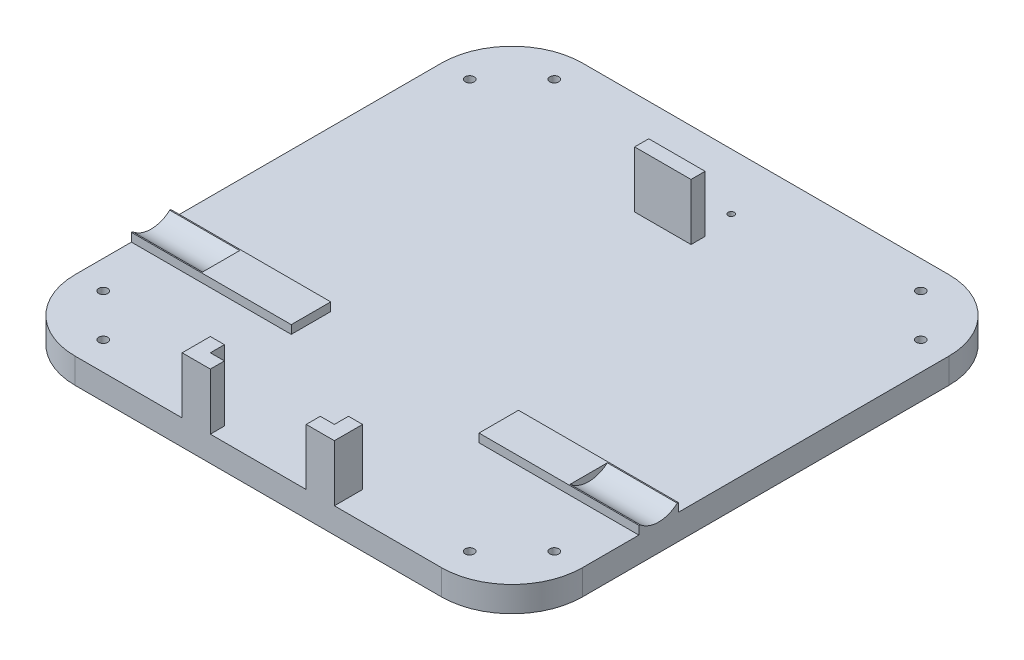
from build123d import *

# Parameters (mm, degrees)
PLATE_DEPTH         = 9
SKETCH2_R           = 1.09
CASTER_HOLES_DEPTH  = 128.597021909
SKETCH3_R           = 1.6
HEX_HOLES_DEPTH     = 128.597021909
SKETCH4_W           = 20
SKETCH4_H           = 5
BOSS_EXTRUDE1_DEPTH = 20
SKETCH5_W           = 56.7
SKETCH5_H           = 14
BOSS_EXTRUDE2_DEPTH = 3
SKETCH6_R           = 10
CUT_EXTRUDE1_DEPTH  = 24.8
CUT_EXTRUDE2_START  = -24.8
SKETCH7_R           = 10
CUT_EXTRUDE2_DEPTH  = 24.8


with BuildPart() as part:
    # Sketch1 → Plate (new body)
    with BuildSketch(Plane(origin=(0, 0, 0), x_dir=(1, 0, 0), z_dir=(0, 1, 0))):
        with BuildLine():
            Line((-65, -90), (65, -90))
            ThreePointArc((65, -90), (82.67766953, -82.67766953), (90, -65))
            Line((90, -65), (90, 65))
            ThreePointArc((90, 65), (82.67766953, 82.67766953), (65, 90))
            Line((65, 90), (-65, 90))
            ThreePointArc((-65, 90), (-82.67766953, 82.67766953), (-90, 65))
            Line((-90, 65), (-90, -65))
            ThreePointArc((-90, -65), (-82.67766953, -82.67766953), (-65, -90))
        make_face()
    extrude(amount=PLATE_DEPTH)

    # Sketch2 → Caster Holes (cut, through all)
    with BuildSketch(Plane(origin=(0, 9, 0), x_dir=(1, 0, 0), z_dir=(0, 1, 0))):
        with Locations((-7.747, 70)):
            Circle(SKETCH2_R)
        with Locations((7.747, 70)):
            Circle(SKETCH2_R)
    extrude(amount=-CASTER_HOLES_DEPTH, mode=Mode.SUBTRACT)

    # Sketch3 → Hex Holes (cut, through all)
    with BuildSketch(Plane(origin=(0, 9, 0), x_dir=(1, 0, 0), z_dir=(0, 1, 0))):
        with Locations((-65, 80)):
            Circle(SKETCH3_R)
        with Locations((-80, 65)):
            Circle(SKETCH3_R)
        with Locations((80, 65)):
            Circle(SKETCH3_R)
        with Locations((80, -65)):
            Circle(SKETCH3_R)
        with Locations((65, 80)):
            Circle(SKETCH3_R)
        with Locations((65, -80)):
            Circle(SKETCH3_R)
        with Locations((-65, -80)):
            Circle(SKETCH3_R)
        with Locations((-80, -65)):
            Circle(SKETCH3_R)
    extrude(amount=-HEX_HOLES_DEPTH, mode=Mode.SUBTRACT)

    # Sketch4 → Boss-Extrude1 (add)
    with BuildSketch(Plane(origin=(0, 9, 0), x_dir=(1, 0, 0), z_dir=(0, 1, 0))):
        Polygon((-27, -90), (-27, -80), (-22, -80), (-22, -85), (-17, -85), (-17, -90), align=None)
        Polygon((17, -90), (17, -85), (22, -85), (22, -80), (27, -80), (27, -90), align=None)
        with Locations((0, 56)):
            Rectangle(SKETCH4_W, SKETCH4_H)
    extrude(amount=BOSS_EXTRUDE1_DEPTH)

    # Sketch5 → Boss-Extrude2 (add)
    with BuildSketch(Plane(origin=(0, 9, 0), x_dir=(1, 0, 0), z_dir=(0, 1, 0))):
        with Locations((-61.65, -38)):
            Rectangle(SKETCH5_W, SKETCH5_H)
        with Locations((61.65, -38)):
            Rectangle(SKETCH5_W, SKETCH5_H)
    extrude(amount=BOSS_EXTRUDE2_DEPTH)

    # Sketch6 → Cut-Extrude1 (cut)
    with BuildSketch(Plane.ZY.offset(90)):
        with Locations((38, 19.5)):
            Circle(SKETCH6_R)
    extrude(amount=-CUT_EXTRUDE1_DEPTH, mode=Mode.SUBTRACT)

    # Sketch7 → Cut-Extrude2 (cut)
    with BuildSketch(Plane(origin=(90, 0, 0), x_dir=(0, 0, -1), z_dir=(1, 0, 0)).offset(CUT_EXTRUDE2_START)):
        with Locations((-38, 19.5)):
            Circle(SKETCH7_R)
    extrude(amount=CUT_EXTRUDE2_DEPTH, mode=Mode.SUBTRACT)


solid = part.part
